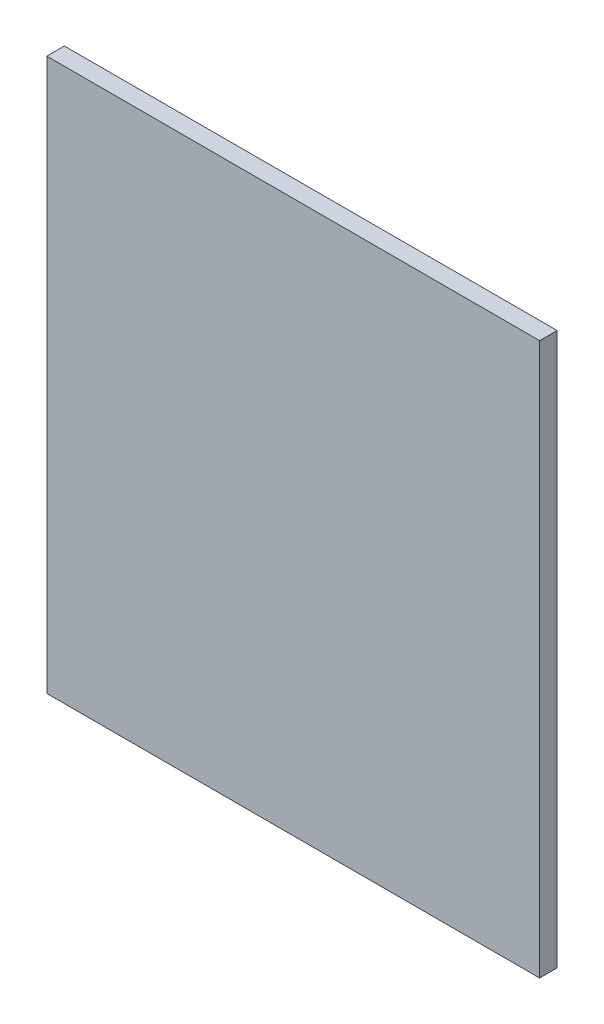
from build123d import *

# Parameters (mm, degrees)
BOSS_EXTRUDE1_DEPTH = 3.18


with BuildPart() as part:
    # Sketch1 → Boss-Extrude1 (new body)
    with BuildSketch(Plane.XY):
        Polygon((-44.645, 50), (-14.881666667, 50), (14.881666667, 50), (44.645, 50), (44.645, -50), (-44.645, -50), align=None)
    extrude(amount=BOSS_EXTRUDE1_DEPTH)


solid = part.part
